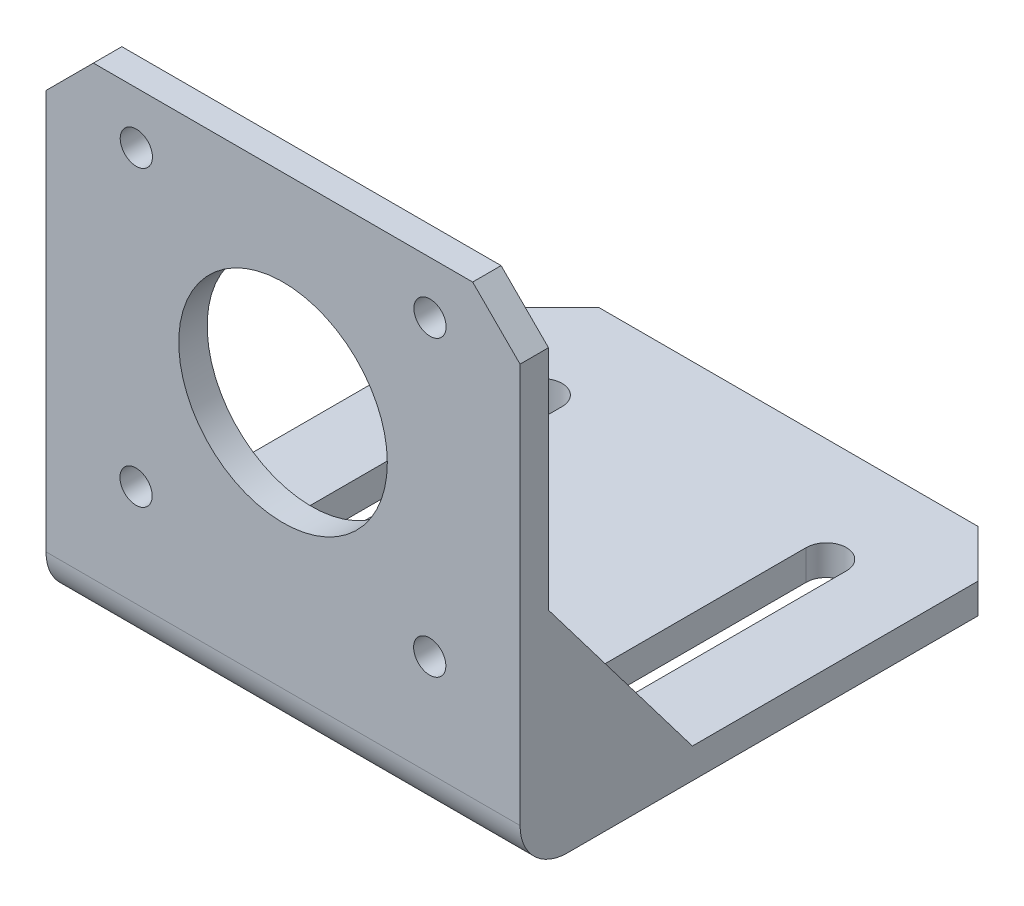
from build123d import *

# Parameters (mm, degrees)
SKETCH1_W           = 50
SKETCH1_H           = 53.3
BOSS_EXTRUDE1_DEPTH = 3.175
SKETCH2_W           = 50
SKETCH2_H           = 3
BOSS_EXTRUDE2_DEPTH = 48.97
SKETCH3_W           = 3.175
SKETCH3_H           = 15
SKETCH3_H_2         = 15.175
BOSS_EXTRUDE3_DEPTH = 20
CUT_EXTRUDE1_DEPTH  = 65
SKETCH5_R           = 11
SKETCH5_R_2         = 1.7
CUT_EXTRUDE2_DEPTH  = 65
CUT_EXTRUDE3_DEPTH  = 65
CHAMFER1_SIZE       = 5
FILLET1_R           = 5


with BuildPart() as part:
    # Sketch1 → Boss-Extrude1 (new body)
    with BuildSketch(Plane(origin=(0, 0, 0), x_dir=(1, 0, 0), z_dir=(0, 1, 0))):
        with Locations((25, 26.65)):
            Rectangle(SKETCH1_W, SKETCH1_H)
    extrude(amount=BOSS_EXTRUDE1_DEPTH)

    # Sketch2 → Boss-Extrude2 (add)
    with BuildSketch(Plane(origin=(0, 3.175, 0), x_dir=(1, 0, 0), z_dir=(0, 1, 0))):
        with Locations((25, 1.5)):
            Rectangle(SKETCH2_W, SKETCH2_H)
    extrude(amount=BOSS_EXTRUDE2_DEPTH)

    # Sketch3 → Boss-Extrude3 (add)
    with BuildSketch(Plane(origin=(0, 3.175, 0), x_dir=(1, 0, 0), z_dir=(0, 1, 0))):
        with Locations((1.5875, 10.5)):
            Rectangle(SKETCH3_W, SKETCH3_H)
        with Locations((48.4125, 10.5875)):
            Rectangle(SKETCH3_W, SKETCH3_H_2)
    extrude(amount=BOSS_EXTRUDE3_DEPTH)

    # Sketch4 → Cut-Extrude1 (cut)
    with BuildSketch(Plane(origin=(50, 0, 0), x_dir=(0, 0, -1), z_dir=(1, 0, 0))):
        Polygon((18.175, 3.175), (3, 23.175), (18.175, 23.175), align=None)
    extrude(amount=-CUT_EXTRUDE1_DEPTH, mode=Mode.SUBTRACT)

    # Sketch5 → Cut-Extrude2 (cut)
    with BuildSketch(Plane.XY):
        with Locations((25, 31.145)):
            Circle(SKETCH5_R)
        with Locations((40.502, 46.647)):
            Circle(SKETCH5_R_2)
        with Locations((9.528, 46.677)):
            Circle(SKETCH5_R_2)
        with Locations((9.498, 15.703)):
            Circle(SKETCH5_R_2)
        with Locations((40.472, 15.673)):
            Circle(SKETCH5_R_2)
    extrude(amount=-CUT_EXTRUDE2_DEPTH, mode=Mode.SUBTRACT)

    # Sketch6 → Cut-Extrude3 (cut)
    with BuildSketch(Plane(origin=(0, 3.175, 0), x_dir=(1, 0, 0), z_dir=(0, 1, 0))):
        with BuildLine():
            ThreePointArc((42.125, 42.3), (40, 44.425), (37.875, 42.3))
            Line((37.875, 42.3), (37.875, 12.3))
            ThreePointArc((37.875, 12.3), (40, 10.175), (42.125, 12.3))
            Line((42.125, 12.3), (42.125, 42.3))
        make_face()
        with BuildLine():
            Line((12.125, 12.3), (12.125, 42.3))
            ThreePointArc((12.125, 42.3), (10, 44.425), (7.875, 42.3))
            Line((7.875, 42.3), (7.875, 12.3))
            ThreePointArc((7.875, 12.3), (10, 10.175), (12.125, 12.3))
        make_face()
    extrude(amount=-CUT_EXTRUDE3_DEPTH, mode=Mode.SUBTRACT)

    # Chamfer1
    chamfer1_edges = [part.edges().sort_by_distance(p)[0] for p in [
        (0, 1.5875, -53.3),
        (50, 1.5875, -53.3),
        (0, 52.145, -1.5),
        (50, 52.145, -1.5),
    ]]
    chamfer(chamfer1_edges, length=CHAMFER1_SIZE)

    # Fillet1
    fillet1_edges = [part.edges().sort_by_distance(p)[0] for p in [
        (25, 3.175, -3),
        (25, 0, 0),
    ]]
    fillet(fillet1_edges, radius=FILLET1_R)


solid = part.part
